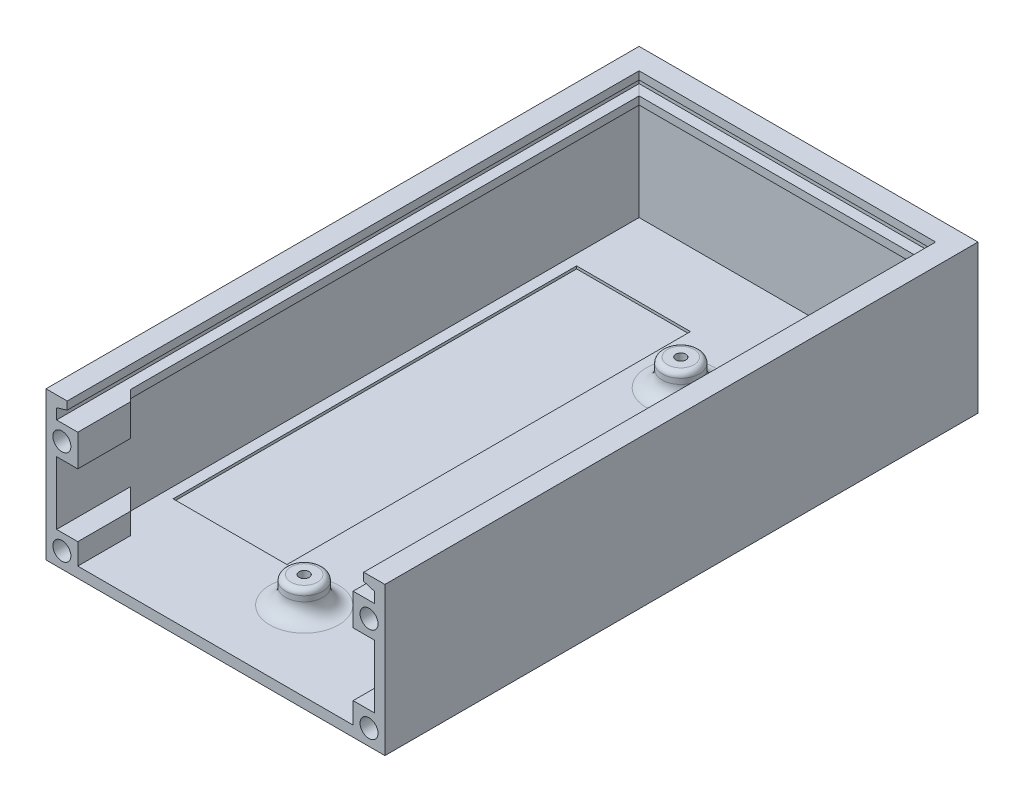
from build123d import *

# Parameters (mm, degrees)
SKIZZE1_W                            = 64
SKIZZE1_H                            = 28
AUFSATZ_LINEAR_AUSTRAGEN1_DEPTH      = 2
AUFSATZ_LINEAR_AUSTRAGEN2_DEPTH      = 110
AUSTRAGUNG1_OUTLINE_W                = 56
AUSTRAGUNG1_OUTLINE_H                = 1.5
AUSTRAGUNG1_DEPTH                    = 4
AUSTRAGUNG1_2_OUTLINE_W              = 2
AUSTRAGUNG1_2_OUTLINE_H              = 1.5
AUSTRAGUNG1_2_DEPTH                  = 112
AUSTRAGUNG1_START                    = 1
AUSTRAGUNG1_3_DEPTH                  = 62
SKIZZE8_W                            = 4
SKIZZE8_H                            = 4
SKIZZE8_H_2                          = 6
AUFSATZ_LINEAR_AUSTRAGEN4_DEPTH      = 10
F_3_4_3_4_DURCHMESSER_BOHRUNG1_D     = 3.4
F_3_4_3_4_DURCHMESSER_BOHRUNG1_DEPTH = 6
F_3_4_3_4_DURCHMESSER_BOHRUNG1_TIP   = 1.021463052
FASE1_SIZE                           = 4
SKIZZE11_W                           = 21.5
SKIZZE11_H                           = 76.2
SCHNITT_LINEAR_AUSTRAGEN1_DEPTH      = 0.5
SKIZZE12_R                           = 3.5
AUFSATZ_LINEAR_AUSTRAGEN5_DEPTH      = 5
F_1_9_1_9_DURCHMESSER_BOHRUNG2_D     = 1.9
F_1_9_1_9_DURCHMESSER_BOHRUNG2_DEPTH = 5
F_1_9_1_9_DURCHMESSER_BOHRUNG2_TIP   = 0.570817588
VERRUNDUNG1_R                        = 3
VERRUNDUNG2_R                        = 1


with BuildPart() as part:
    # Skizze1 → Aufsatz-Linear austragen1 (new body)
    with BuildSketch(Plane.XY):
        with Locations((32, 14)):
            Rectangle(SKIZZE1_W, SKIZZE1_H)
    extrude(amount=AUFSATZ_LINEAR_AUSTRAGEN1_DEPTH)

    # Skizze2 → Aufsatz-Linear austragen2 (add)
    with BuildSketch(Plane.XY.offset(2)):
        Polygon((0, 28), (0, 0), (64, 0), (64, 28), (62, 28), (62, 2), (2, 2), (2, 28), align=None)
    extrude(amount=AUFSATZ_LINEAR_AUSTRAGEN2_DEPTH)

    # Austragung1: read off the stored shape, not the designer's step
    # Austragung1 outline → Austragung1 (add)
    with BuildSketch(Plane.XY):
        with Locations((32, 23.15)):
            Rectangle(AUSTRAGUNG1_OUTLINE_W, AUSTRAGUNG1_OUTLINE_H)
    extrude(amount=AUSTRAGUNG1_DEPTH)

    # Austragung1 2 outline → Austragung1 2 (add)
    with BuildSketch(Plane.XY):
        Polygon((4, 28), (2, 28), (2, 25.9), (4, 26.5), align=None)
        Polygon((62, 28), (60, 28), (60, 26.5), (62, 25.9), align=None)
        with Locations((3, 23.15)):
            Rectangle(AUSTRAGUNG1_2_OUTLINE_W, AUSTRAGUNG1_2_OUTLINE_H)
        with Locations((61, 23.15)):
            Rectangle(AUSTRAGUNG1_2_OUTLINE_W, AUSTRAGUNG1_2_OUTLINE_H)
    extrude(amount=AUSTRAGUNG1_2_DEPTH)

    # Austragung1 3 outline → Austragung1 3 (add)
    with BuildSketch(Plane.YZ.offset(AUSTRAGUNG1_START)):
        Polygon((28, 4), (26.5, 4), (25.9, 2), (28, 2), align=None)
    extrude(amount=AUSTRAGUNG1_3_DEPTH)

    # Skizze8 → Aufsatz-Linear austragen4 (add)
    with BuildSketch(Plane.XY.offset(112)):
        with Locations((4, 4)):
            Rectangle(SKIZZE8_W, SKIZZE8_H)
        with Locations((60, 4)):
            Rectangle(SKIZZE8_W, SKIZZE8_H)
        with Locations((60, 20.9)):
            Rectangle(SKIZZE8_W, SKIZZE8_H_2)
        with Locations((4, 20.9)):
            Rectangle(SKIZZE8_W, SKIZZE8_H_2)
    extrude(amount=-AUFSATZ_LINEAR_AUSTRAGEN4_DEPTH)

    # Ø3.4 (3.4) Durchmesser Bohrung1
    with Locations(Plane.XY.offset(112)):
        with Locations((3, 20.9), (3, 3), (61, 20.9), (61, 3)):
            Hole(F_3_4_3_4_DURCHMESSER_BOHRUNG1_D / 2, depth=F_3_4_3_4_DURCHMESSER_BOHRUNG1_DEPTH)
            with Locations((0, 0, -(F_3_4_3_4_DURCHMESSER_BOHRUNG1_DEPTH + F_3_4_3_4_DURCHMESSER_BOHRUNG1_TIP / 2))):  # 118° drill point
                Cone(0, F_3_4_3_4_DURCHMESSER_BOHRUNG1_D / 2, F_3_4_3_4_DURCHMESSER_BOHRUNG1_TIP, mode=Mode.SUBTRACT)

    # Fase1
    fase1_edges = [part.edges().sort_by_distance(p)[0] for p in [
        (2, 20.15, 102),
        (2, 4, 102),
        (62, 20.15, 102),
        (62, 4, 102),
    ]]
    chamfer(fase1_edges, length=FASE1_SIZE - 0.0001)  # a hair under: the kernel refuses the full size

    # Skizze11 → Schnitt-Linear austragen1 (cut)
    with BuildSketch(Plane(origin=(0, 2, 0), x_dir=(1, 0, 0), z_dir=(0, 1, 0))):
        with Locations((14.75, -53.9)):
            Rectangle(SKIZZE11_W, SKIZZE11_H)
    extrude(amount=-SCHNITT_LINEAR_AUSTRAGEN1_DEPTH, mode=Mode.SUBTRACT)

    # Skizze12 → Aufsatz-Linear austragen5 (add)
    with BuildSketch(Plane(origin=(0, 2, 0), x_dir=(1, 0, 0), z_dir=(0, 1, 0))):
        with Locations((57, -97)):
            Circle(SKIZZE12_R)
        with Locations((33.76, -97)):
            Circle(SKIZZE12_R)
        with Locations((33.76, -25.88)):
            Circle(SKIZZE12_R)
        with Locations((57, -25.88)):
            Circle(SKIZZE12_R)
    extrude(amount=AUFSATZ_LINEAR_AUSTRAGEN5_DEPTH)

    # Ø1.9 (1.9) Durchmesser Bohrung2
    with Locations(Plane(origin=(0, 7, 0), x_dir=(1, 0, 0), z_dir=(0, 1, 0))):
        with Locations((33.76, -25.88), (57, -25.88), (57, -97), (33.76, -97)):
            Hole(F_1_9_1_9_DURCHMESSER_BOHRUNG2_D / 2, depth=F_1_9_1_9_DURCHMESSER_BOHRUNG2_DEPTH)
            with Locations((0, 0, -(F_1_9_1_9_DURCHMESSER_BOHRUNG2_DEPTH + F_1_9_1_9_DURCHMESSER_BOHRUNG2_TIP / 2))):  # 118° drill point
                Cone(0, F_1_9_1_9_DURCHMESSER_BOHRUNG2_D / 2, F_1_9_1_9_DURCHMESSER_BOHRUNG2_TIP, mode=Mode.SUBTRACT)

    # Verrundung1
    # the kernel refuses this fillet: 3 mm, written as the material it adds along each edge
    with BuildSketch(Plane(origin=(57, 2, 97), x_dir=(1, 0, 0), z_dir=(0, 0, 1))) as verrundung1_piece_1:
        with BuildLine():
            CenterArc((3.5 + VERRUNDUNG1_R, VERRUNDUNG1_R), VERRUNDUNG1_R, 180, 90)
            Line((3.5, VERRUNDUNG1_R), (3.5, 0))
            Line((3.5, 0), (3.5 + VERRUNDUNG1_R, 0))
        make_face()
    revolve(axis=Axis((57, 2, 97), (0, 1, 0)))
    with BuildSketch(Plane(origin=(33.76, 2, 97), x_dir=(1, 0, 0), z_dir=(0, 0, 1))) as verrundung1_piece_2:
        with BuildLine():
            CenterArc((3.5 + VERRUNDUNG1_R, VERRUNDUNG1_R), VERRUNDUNG1_R, 180, 90)
            Line((3.5, VERRUNDUNG1_R), (3.5, 0))
            Line((3.5, 0), (3.5 + VERRUNDUNG1_R, 0))
        make_face()
    revolve(axis=Axis((33.76, 2, 97), (0, 1, 0)))
    with BuildSketch(Plane(origin=(57, 2, 25.88), x_dir=(1, 0, 0), z_dir=(0, 0, 1))) as verrundung1_piece_3:
        with BuildLine():
            CenterArc((3.5 + VERRUNDUNG1_R, VERRUNDUNG1_R), VERRUNDUNG1_R, 180, 90)
            Line((3.5, VERRUNDUNG1_R), (3.5, 0))
            Line((3.5, 0), (3.5 + VERRUNDUNG1_R, 0))
        make_face()
    revolve(axis=Axis((57, 2, 25.88), (0, 1, 0)))
    with BuildSketch(Plane(origin=(33.76, 2, 25.88), x_dir=(1, 0, 0), z_dir=(0, 0, 1))) as verrundung1_piece_4:
        with BuildLine():
            CenterArc((3.5 + VERRUNDUNG1_R, VERRUNDUNG1_R), VERRUNDUNG1_R, 180, 90)
            Line((3.5, VERRUNDUNG1_R), (3.5, 0))
            Line((3.5, 0), (3.5 + VERRUNDUNG1_R, 0))
        make_face()
    revolve(axis=Axis((33.76, 2, 25.88), (0, 1, 0)))

    # Verrundung2
    verrundung2_edges = [part.edges().sort_by_distance(p)[0] for p in [
        (53.5, 7, 25.88),
        (30.26, 7, 25.88),
        (30.26, 7, 97),
        (53.5, 7, 97),
    ]]
    fillet(verrundung2_edges, radius=VERRUNDUNG2_R)


solid = part.part
